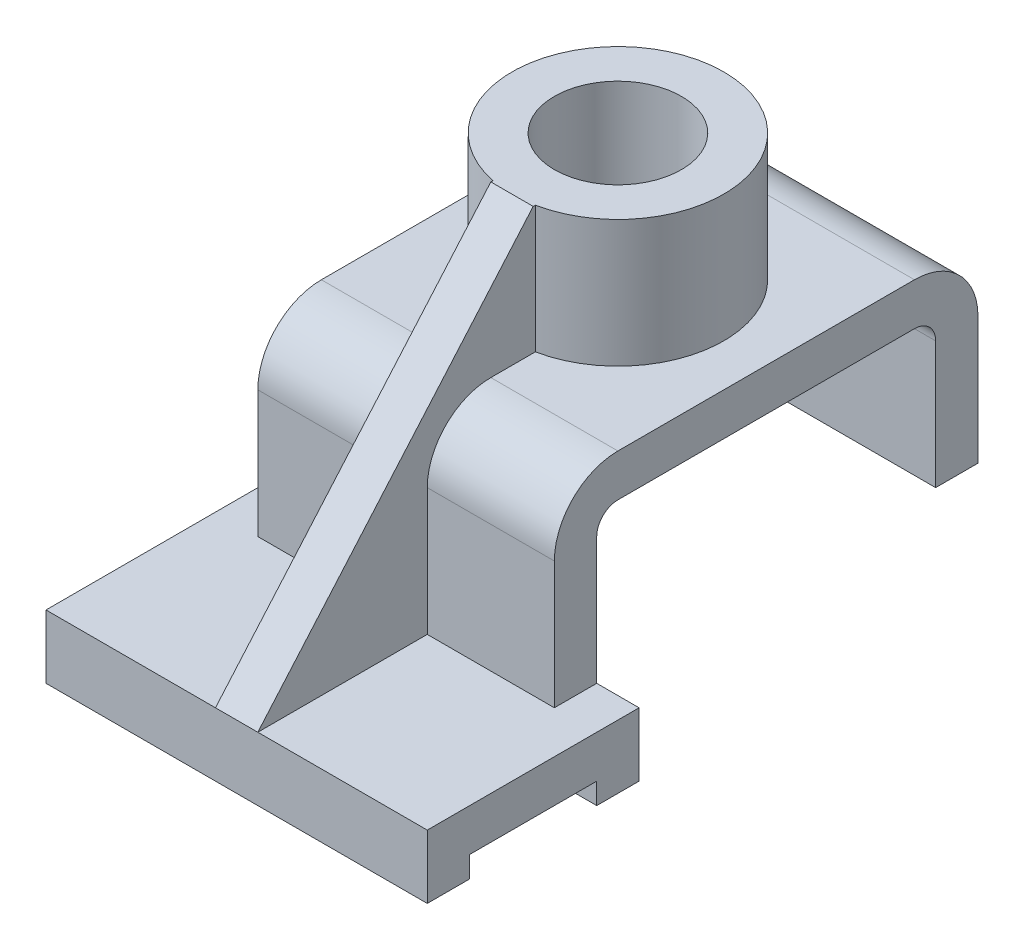
from build123d import *

# Parameters (mm, degrees)
BOSS_EXTRUDE1_DEPTH = 45
BOSS_EXTRUDE2_START = -10
BOSS_EXTRUDE2_DEPTH = 70
SKETCH5_R           = 25
SKETCH5_R_2         = 15
BOSS_EXTRUDE3_DEPTH = 30
RIB3_START          = -5
RIB3_DEPTH          = 10


with BuildPart() as part:
    # Sketch1 → Boss-Extrude1 (new, symmetric)
    with BuildSketch(Plane(origin=(0, 0, 0), x_dir=(0, 0, -1), z_dir=(1, 0, 0))):
        Polygon((-20.642857143, -6.642857143), (-30.642857143, -6.642857143), (-30.642857143, 8.357142857), (19.357142857, 8.357142857), (19.357142857, -6.642857143), (9.357142857, -6.642857143), (9.357142857, -1.642857143), (-20.642857143, -1.642857143), align=None)
    extrude(amount=BOSS_EXTRUDE1_DEPTH, both=True)

    # Sketch2 → Boss-Extrude2 (add)
    with BuildSketch(Plane(origin=(45, 0, 0), x_dir=(0, 0, -1), z_dir=(1, 0, 0)).offset(BOSS_EXTRUDE2_START)):
        with BuildLine():
            Line((19.357142857, 8.357142857), (19.357142857, 38.357142857))
            ThreePointArc((19.357142857, 38.357142857), (20.821608951, 41.892676763), (24.357142857, 43.357142857))
            Line((24.357142857, 43.357142857), (94.357142857, 43.357142857))
            ThreePointArc((94.357142857, 43.357142857), (97.892676763, 41.892676763), (99.357142857, 38.357142857))
            Line((99.357142857, 38.357142857), (99.357142857, 8.357142857))
            Line((99.357142857, 8.357142857), (109.357142857, 8.357142857))
            Line((109.357142857, 8.357142857), (109.357142857, 38.357142857))
            ThreePointArc((109.357142857, 38.357142857), (104.963744575, 48.963744575), (94.357142857, 53.357142857))
            Line((94.357142857, 53.357142857), (24.357142857, 53.357142857))
            ThreePointArc((24.357142857, 53.357142857), (13.750541139, 48.963744575), (9.357142857, 38.357142857))
            Line((9.357142857, 38.357142857), (9.357142857, 8.357142857))
            Line((9.357142857, 8.357142857), (19.357142857, 8.357142857))
        make_face()
    extrude(amount=-BOSS_EXTRUDE2_DEPTH)

    # Sketch5 → Boss-Extrude3 (add)
    with BuildSketch(Plane(origin=(0, 53.357142857, 0), x_dir=(1, 0, 0), z_dir=(0, 1, 0))):
        with Locations(Location((0, 59.357142857, 0), (0, 0, 270))):
            Circle(SKETCH5_R)
        with Locations(Location((0, 59.357142857, 0), (0, 0, 270))):
            Circle(SKETCH5_R_2, mode=Mode.SUBTRACT)
    extrude(amount=BOSS_EXTRUDE3_DEPTH)

    # Rib3: read off the stored shape, not the designer's step
    # Rib3 outline → Rib3 (add)
    with BuildSketch(Plane(origin=(0, 0, 0), x_dir=(0, 0, -1), z_dir=(1, 0, 0)).offset(RIB3_START)):
        with BuildLine():
            Line((34.862245429, 83.357142857), (34.357142857, 83.357142857))
            Line((34.357142857, 83.357142857), (-30.642857143, 8.357142857))
            Line((-30.642857143, 8.357142857), (9.357142857, 8.357142857))
            Line((9.357142857, 8.357142857), (9.357142857, 38.357142857))
            ThreePointArc((9.357142857, 38.357142857), (13.750541139, 48.963744575), (24.357142857, 53.357142857))
            Line((24.357142857, 53.357142857), (34.862245429, 53.357142857))
            Line((34.862245429, 53.357142857), (34.862245429, 83.357142857))
        make_face()
    extrude(amount=RIB3_DEPTH)


solid = part.part
